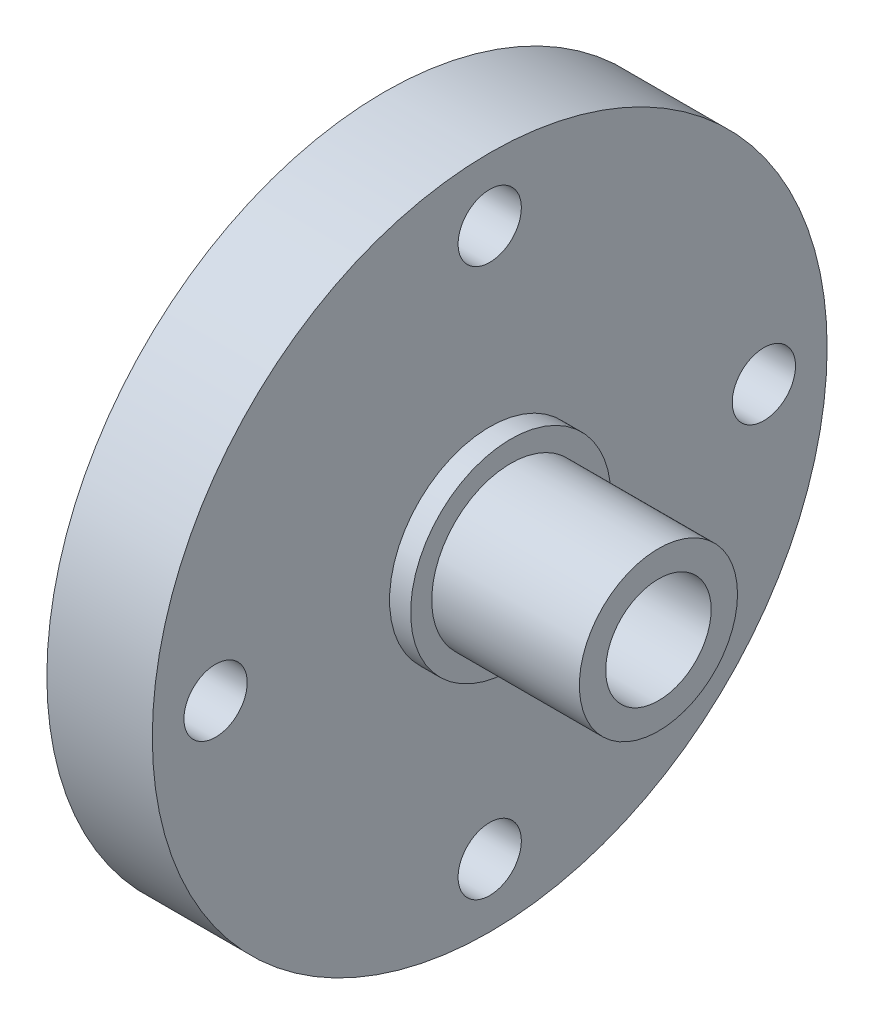
from build123d import *

# Parameters (mm, degrees)
SKETCH1_R           = 16
SKETCH1_R_2         = 2.5
BOSS_EXTRUDE1_DEPTH = 5
SKETCH2_R           = 1.5
CUT_EXTRUDE1_DEPTH  = 24.173260453
SKETCH4_R           = 4.75
SKETCH4_R_2         = 2.5
BOSS_EXTRUDE2_DEPTH = 1
SKETCH5_R           = 3.75
SKETCH5_R_2         = 2.5
BOSS_EXTRUDE3_DEPTH = 7


with BuildPart() as part:
    # Sketch1 → Boss-Extrude1 (new body)
    with BuildSketch(Plane(origin=(0, 0, 0), x_dir=(0, 0, -1), z_dir=(1, 0, 0))):
        Circle(SKETCH1_R)
        Circle(SKETCH1_R_2, mode=Mode.SUBTRACT)
    extrude(amount=BOSS_EXTRUDE1_DEPTH)

    # Sketch2 → Cut-Extrude1 (cut, through all)
    with BuildSketch(Plane(origin=(5, 0, 0), x_dir=(0, 0, -1), z_dir=(1, 0, 0))):
        with Locations((0, 13)):
            Circle(SKETCH2_R)
        with Locations((13, 0)):
            Circle(SKETCH2_R)
        with Locations((0, -13)):
            Circle(SKETCH2_R)
        with Locations((-13, 0)):
            Circle(SKETCH2_R)
    extrude(amount=-CUT_EXTRUDE1_DEPTH, mode=Mode.SUBTRACT)

    # Sketch4 → Boss-Extrude2 (add)
    with BuildSketch(Plane(origin=(5, 0, 0), x_dir=(0, 0, -1), z_dir=(1, 0, 0))):
        Circle(SKETCH4_R)
        Circle(SKETCH4_R_2, mode=Mode.SUBTRACT)
    extrude(amount=BOSS_EXTRUDE2_DEPTH)

    # Sketch5 → Boss-Extrude3 (add)
    with BuildSketch(Plane(origin=(6, 0, 0), x_dir=(0, 0, -1), z_dir=(1, 0, 0))):
        Circle(SKETCH5_R)
        Circle(SKETCH5_R_2, mode=Mode.SUBTRACT)
    extrude(amount=BOSS_EXTRUDE3_DEPTH)


solid = part.part
